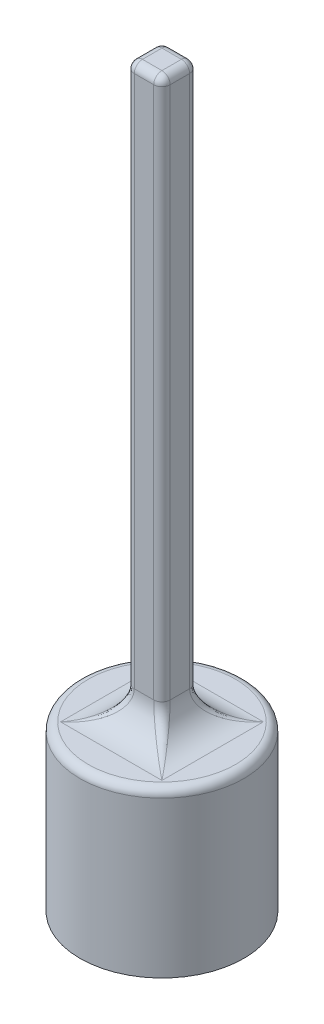
from build123d import *

# Parameters (mm, degrees)
SKETCH1_R           = 6.35
BOSS_EXTRUDE1_DEPTH = 12.7
SKETCH2_W           = 2.778125
SKETCH2_H           = 2.778125
BOSS_EXTRUDE2_DEPTH = 44.45
FILLET1_R           = 2.54
FILLET2_R           = 0.635
CUT_EXTRUDE1_DEPTH  = 10.033
FILLET3_R           = 3.175


with BuildPart() as part:
    # Sketch1 → Boss-Extrude1 (new body)
    with BuildSketch(Plane(origin=(0, 0, 0), x_dir=(0, 0, -1), z_dir=(0, 1, 0))):
        Circle(SKETCH1_R)
    extrude(amount=BOSS_EXTRUDE1_DEPTH)

    # Sketch2 → Boss-Extrude2 (add)
    with BuildSketch(Plane(origin=(-12.7, 12.7, 0), x_dir=(0, 0, -1), z_dir=(0, -1, 0))):
        with Locations((0, 12.7)):
            Rectangle(SKETCH2_W, SKETCH2_H)
    extrude(amount=-BOSS_EXTRUDE2_DEPTH)

    # Fillet1
    fillet1_edges = [part.edges().sort_by_distance(p)[0] for p in [
        (0, 12.7, 1.3890625),
        (-1.3890625, 12.7, 0),
        (0, 12.7, -1.3890625),
        (1.3890625, 12.7, 0),
    ]]
    fillet(fillet1_edges, radius=FILLET1_R)

    # Fillet2
    fillet2_edges = [part.edges().sort_by_distance(p)[0] for p in [
        (2.288098215, 13.301228168, 2.288098215),
        (-2.288098198, 13.301228182, 2.288098198),
        (2.288098275, 13.301228117, -2.288098275),
        (-2.288098218, 13.301228166, -2.288098218),
        (1.3890625, 36.195, 1.3890625),
        (-1.3890625, 36.195, 1.3890625),
        (1.3890625, 36.195, -1.3890625),
        (-1.3890625, 36.195, -1.3890625),
        (0, 12.7, 6.35),
        (0, 57.15, -1.3890625),
        (1.3890625, 57.15, 0),
        (0, 57.15, 1.3890625),
        (-1.3890625, 57.15, 0),
    ]]
    fillet(fillet2_edges, radius=FILLET2_R)

    # Sketch3 → Cut-Extrude1 (cut)
    with BuildSketch(Plane.XZ):
        Polygon((-3.3909, 1.957737028), (-3.3909, -1.957737028), (0, -3.915474056), (3.3909, -1.957737028), (3.3909, 1.957737028), (0, 3.915474056), align=None)
    extrude(amount=-CUT_EXTRUDE1_DEPTH, mode=Mode.SUBTRACT)

    # Fillet3
    fillet3_edges = [part.edges().sort_by_distance(p)[0] for p in [
        (1.69545, 10.033, 2.936605542),
        (3.3909, 10.033, 0),
        (1.69545, 10.033, -2.936605542),
        (-1.69545, 10.033, -2.936605542),
        (-3.3909, 10.033, 0),
        (-1.69545, 10.033, 2.936605542),
    ]]
    fillet(fillet3_edges, radius=FILLET3_R)


solid = part.part
